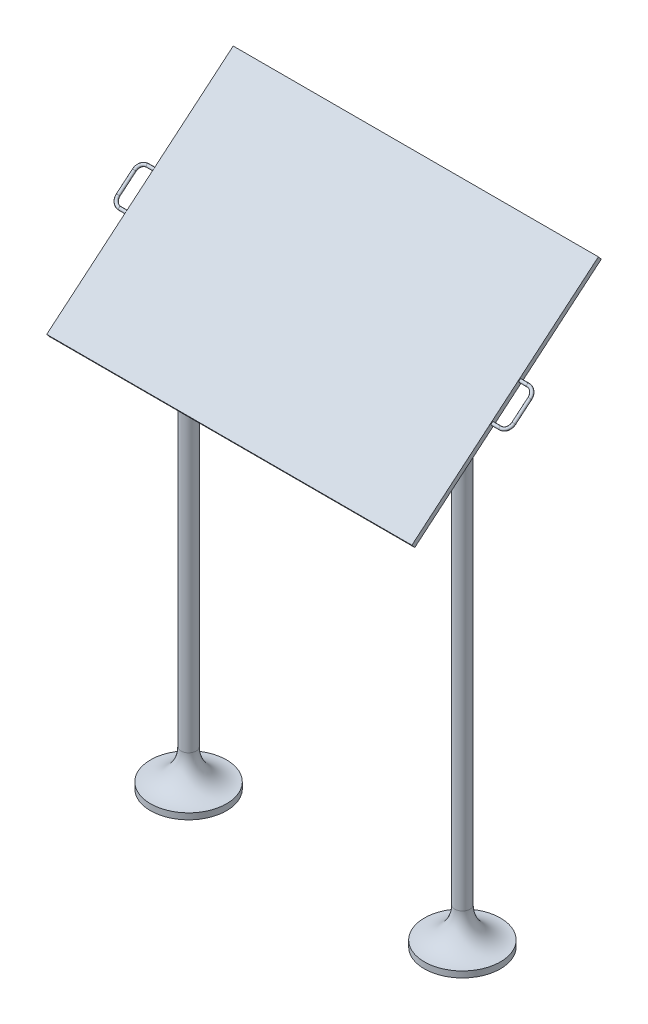
from build123d import *

# Parameters (mm, degrees)
CROQUIS1_R                 = 125
SALIENTE_EXTRUIR1_DEPTH    = 20
SALIENTE_EXTRUIR1_2_DEPTH  = 20
CROQUIS2_R                 = 25
SALIENTE_EXTRUIR2_DEPTH    = 1623.09
REDONDEO1_R                = 100
REDONDEO2_R                = 100
CORTAR_EXTRUIR1_DEPTH      = 1746.277842666
CORTAR_EXTRUIR1_DEPTH_BACK = 1746.277842666
SALIENTE_EXTRUIR3_DEPTH    = 600
CROQUIS9_R                 = 5


with BuildPart() as part:
    # Croquis1 → Saliente-Extruir1 (new body)
    with BuildSketch(Plane(origin=(0, 0, 0), x_dir=(1, 0, 0), z_dir=(0, 1, 0))):
        with Locations(Location((-450, 0, 0), (0, 0, 270))):
            Circle(CROQUIS1_R)
    extrude(amount=SALIENTE_EXTRUIR1_DEPTH)



with BuildPart() as body_2:
    # Croquis1 → Saliente-Extruir1 2 (new body)
    with BuildSketch(Plane(origin=(0, 0, 0), x_dir=(1, 0, 0), z_dir=(0, 1, 0))):
        with Locations(Location((450, 0, 0), (0, 0, 90))):
            Circle(CROQUIS1_R)
    extrude(amount=SALIENTE_EXTRUIR1_2_DEPTH)


with BuildPart() as part_1:
    add(part.part)

    add(body_2.part)  # Saliente-Extruir2 merges body 2
    # Croquis2 → Saliente-Extruir2 (add)
    with BuildSketch(Plane(origin=(0, 20, 0), x_dir=(1, 0, 0), z_dir=(0, 1, 0))):
        with Locations(Location((-450, 0, 0), (0, 0, 90))):
            Circle(CROQUIS2_R)
        with Locations(Location((450, 0, 0), (0, 0, 90))):
            Circle(CROQUIS2_R)
    extrude(amount=SALIENTE_EXTRUIR2_DEPTH)

    # Redondeo1
    redondeo1_edges = [part_1.edges().sort_by_distance(p)[0] for p in [
        (-450, 20, 25),
    ]]
    fillet(redondeo1_edges, radius=REDONDEO1_R - 0.0001)  # a hair under: the kernel refuses the full size

    # Redondeo2
    redondeo2_edges = [part_1.edges().sort_by_distance(p)[0] for p in [
        (450, 20, 25),
    ]]
    fillet(redondeo2_edges, radius=REDONDEO2_R - 0.0001)  # a hair under: the kernel refuses the full size

    # Croquis5 → Cortar-Extruir1 (cut, two sides: drawn at the far end of the back side and taken through both)
    with BuildSketch(Plane(origin=(0, 0, 0), x_dir=(0, 0, -1), z_dir=(1, 0, 0)).offset(-CORTAR_EXTRUIR1_DEPTH_BACK)):
        Polygon((25, 1643.09), (-25, 1601.135018441), (-25, 1643.09), align=None)
    extrude(amount=CORTAR_EXTRUIR1_DEPTH + CORTAR_EXTRUIR1_DEPTH_BACK, mode=Mode.SUBTRACT)


with BuildPart() as body_2_2:
    # Croquis3 → Saliente-Extruir3 (new, symmetric)
    with BuildSketch(Plane(origin=(0, 0, 0), x_dir=(0, 0, -1), z_dir=(1, 0, 0))):
        Polygon((-306.417777248, 1364.997465346), (306.417777248, 1879.227553095), (296.775963102, 1890.718219742), (-316.059591393, 1376.488131993), align=None)
    extrude(amount=SALIENTE_EXTRUIR3_DEPTH, both=True)

    # Barrer1: sweep along a path in Croquis10
    with BuildLine(Plane(origin=(0, 963.385361856, 808.376301815), x_dir=(1, 0, 0), z_dir=(0, 0.7660444431189809, 0.6427876096865359))) as barrer1_path:
        Line((600, 1102.203226943), (625, 1102.203226943))
        ThreePointArc((625, 1102.203226943), (642.67766953, 1094.880896473), (650, 1077.203226943))
        Line((650, 1077.203226943), (650, 1008.144417946))
        ThreePointArc((650, 1008.144417946), (642.67766953, 990.466748416), (625, 983.144417946))
        Line((625, 983.144417946), (600, 983.144417946))
    # Croquis9 → Barrer1 (sweep)
    with BuildSketch(Plane(origin=(600, 0, 0), x_dir=(0, 0, -1), z_dir=(1, 0, 0))):
        with Locations((40.781262446, 1666.122606168)):
            Circle(CROQUIS9_R)
    barrer1 = sweep(path=barrer1_path.line)

    # Simetría1: Barrer1 across plane
    add(barrer1.mirror(Plane(origin=(0, 0, 0), x_dir=(0, 0, 1), z_dir=(1, 0, 0))))


solid = Compound([part_1.part, body_2_2.part])
